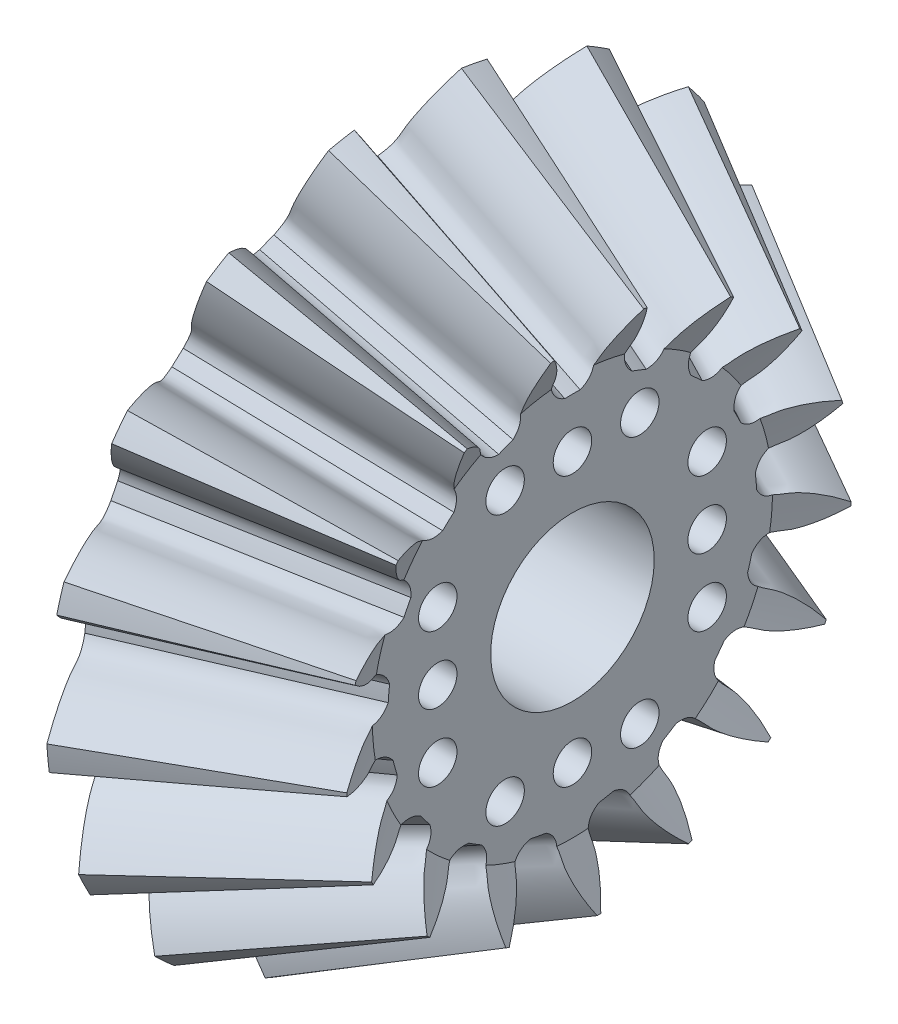
from build123d import *

# Parameters (mm, degrees)
CUT_EXTRUDE1_DEPTH = 33.856357099
CIRPATTERN1_COUNT  = 17
SKETCH2_R          = 11.25
CUT_EXTRUDE2_DEPTH = 5
SKETCH3_R          = 1
CUT_EXTRUDE3_DEPTH = 28.671691276
SKETCH4_R          = 4.25
CUT_EXTRUDE4_DEPTH = 29.902199624


# Read off the part's stored shape, not the designer's step: 旋转1
with BuildPart() as part:
    # 旋转1 outline → 旋转1 (revolve)
    with BuildSketch(Plane.YX):
        Polygon((1.485337474, 6.528961373), (13.057922746, 6.528961373), (18.788854382, 9.394427191), (13.152198067, 19.326099034), (10.397362319, 17.94868116), (1.485337474, 17.94868116), align=None)
    revolve(axis=Axis((0, 0, 0), (1, 0, 0)))

    # Sketch1 → Cut-Extrude1 (cut, through all)
    with BuildSketch(Plane(origin=(0, 0, 0), x_dir=(0, 0, -1), z_dir=(0.8944271909999161, -0.4472135954999577, -1.0341155557737348e-13))):
        with BuildLine():
            ThreePointArc((0.399763229, 16.595185728), (0, 16.6), (-0.399763229, 16.595185728))
            add(Edge.make_bspline(
                [(-0.399763229, 16.595185728), (-1.198985458, 16.885810963), (-1.124727274, 17.473761407), (-1.250725801, 18.040324932), (-1.265059396, 18.099315382), (-1.282397995, 18.164911887), (-1.30300192, 18.237017032), (-1.32714044, 18.315523096), (-1.35507611, 18.400315004), (-1.387069369, 18.491269511), (-1.42337685, 18.588255562), (-1.464251618, 18.6911343), (-1.509942824, 18.799759186), (-1.560695543, 18.913976092), (-1.616750556, 19.033623408), (-1.678344154, 19.158532155), (-1.745707938, 19.288526099), (-1.819068625, 19.423421874), (-1.898647854, 19.563029105), (-1.984662001, 19.707150543), (-2.077321989, 19.855582194), (-2.176833106, 20.008113467), (-2.28339483, 20.164527312), (-2.397200646, 20.324600373), (-2.518437883, 20.488103141), (-2.64728754, 20.654800111), (-2.783924122, 20.824449945), (-2.928515482, 20.996805638), (-3.081222666, 21.171614689), (-3.242199755, 21.348619274), (-3.411593725, 21.527556429), (-3.589544298, 21.708158223), (-3.776183806, 21.890151954), (-3.971637056, 22.073260331), (-4.176021199, 22.257201669), (-4.389445607, 22.441690087), (-4.612011752, 22.626435702), (-4.843813088, 22.811144839), (-5.084934955, 22.995520228), (-5.335454413, 23.179261223), (-5.685997297, 23.425736863), (-5.957412859, 23.60452901), (-6.142627743, 23.721408504)],
                knots=[0, 0, 0, 0, 0.174183236, 0.179918075, 0.186417559, 0.193681688, 0.201710462, 0.210503881, 0.220061946, 0.230384655, 0.24147201, 0.25332401, 0.265940655, 0.279321945, 0.293467881, 0.308378461, 0.324053687, 0.340493557, 0.357698073, 0.375667234, 0.394401041, 0.413899492, 0.434162589, 0.45519033, 0.476982717, 0.499539749, 0.522861426, 0.546947748, 0.571798716, 0.597414328, 0.623794586, 0.650939489, 0.678849037, 0.70752323, 0.736962068, 0.767165552, 0.79813368, 0.829866454, 0.862363873, 0.895625937, 0.929652646, 1, 1, 1, 1], degree=3))
            ThreePointArc((-6.142627743, 23.721408504), (0, 24.503818009), (6.142627743, 23.721408504))
            add(Edge.make_bspline(
                [(0.399763229, 16.595185728), (1.198985458, 16.885810963), (1.124727274, 17.473761407), (1.250725801, 18.040324932), (1.265059396, 18.099315382), (1.282397995, 18.164911887), (1.30300192, 18.237017032), (1.32714044, 18.315523096), (1.35507611, 18.400315004), (1.387069369, 18.491269511), (1.42337685, 18.588255562), (1.464251618, 18.6911343), (1.509942824, 18.799759186), (1.560695543, 18.913976092), (1.616750556, 19.033623408), (1.678344154, 19.158532155), (1.745707938, 19.288526099), (1.819068625, 19.423421874), (1.898647854, 19.563029105), (1.984662001, 19.707150543), (2.077321989, 19.855582194), (2.176833106, 20.008113467), (2.28339483, 20.164527312), (2.397200646, 20.324600373), (2.518437883, 20.488103141), (2.64728754, 20.654800111), (2.783924122, 20.824449945), (2.928515482, 20.996805638), (3.081222666, 21.171614689), (3.242199755, 21.348619274), (3.411593725, 21.527556429), (3.589544298, 21.708158223), (3.776183806, 21.890151954), (3.971637056, 22.073260331), (4.176021199, 22.257201669), (4.389445607, 22.441690087), (4.612011752, 22.626435702), (4.843813088, 22.811144839), (5.084934955, 22.995520228), (5.335454413, 23.179261223), (5.685997297, 23.425736863), (5.957412859, 23.60452901), (6.142627743, 23.721408504)],
                knots=[0, 0, 0, 0, 0.174183236, 0.179918075, 0.186417559, 0.193681688, 0.201710462, 0.210503881, 0.220061946, 0.230384655, 0.24147201, 0.25332401, 0.265940655, 0.279321945, 0.293467881, 0.308378461, 0.324053687, 0.340493557, 0.357698073, 0.375667234, 0.394401041, 0.413899492, 0.434162589, 0.45519033, 0.476982717, 0.499539749, 0.522861426, 0.546947748, 0.571798716, 0.597414328, 0.623794586, 0.650939489, 0.678849037, 0.70752323, 0.736962068, 0.767165552, 0.79813368, 0.829866454, 0.862363873, 0.895625937, 0.929652646, 1, 1, 1, 1], degree=3))
        make_face()
    cut_extrude1 = extrude(amount=CUT_EXTRUDE1_DEPTH, mode=Mode.SUBTRACT)

    # CirPattern1: Cut-Extrude1 ×17 about axis
    cirpattern1_axis = Axis((17.94868116, 0, 0), (1, 0, 0))
    for i in range(1, CIRPATTERN1_COUNT):
        add(cut_extrude1.rotate(cirpattern1_axis, i * 360 / CIRPATTERN1_COUNT), mode=Mode.SUBTRACT)

    # Sketch2 → Cut-Extrude2 (cut)
    with BuildSketch(Plane.ZY.offset(-6.528961373)):
        Circle(SKETCH2_R)
    extrude(amount=-CUT_EXTRUDE2_DEPTH, mode=Mode.SUBTRACT)

    # Sketch3 → Cut-Extrude3 (cut, through all)
    with BuildSketch(Plane.ZY.offset(-11.528961373)):
        with Locations((0, 7)):
            Circle(SKETCH3_R)
        with Locations((3.5, 7)):
            Circle(SKETCH3_R)
        with Locations(Location((-3.5, 7, 0), (0, 0, 180))):
            Circle(SKETCH3_R)
        with Locations(Location((7, 3.5, 0), (0, 0, 180))):
            Circle(SKETCH3_R)
        with Locations((7, 0)):
            Circle(SKETCH3_R)
        with Locations((7, -3.5)):
            Circle(SKETCH3_R)
        with Locations(Location((3.5, -7, 0), (0, 0, 180))):
            Circle(SKETCH3_R)
        with Locations((0, -7)):
            Circle(SKETCH3_R)
        with Locations((-3.5, -7)):
            Circle(SKETCH3_R)
        with Locations(Location((-7, -3.5, 0), (0, 0, 180))):
            Circle(SKETCH3_R)
        with Locations((-7, 0)):
            Circle(SKETCH3_R)
        with Locations((-7, 3.5)):
            Circle(SKETCH3_R)
    extrude(amount=-CUT_EXTRUDE3_DEPTH, mode=Mode.SUBTRACT)

    # Sketch4 → Cut-Extrude4 (cut, through all)
    with BuildSketch(Plane(origin=(17.94868116, 0, 0), x_dir=(0, 0, -1), z_dir=(1, 0, 0))):
        Circle(SKETCH4_R)
    extrude(amount=-CUT_EXTRUDE4_DEPTH, mode=Mode.SUBTRACT)


solid = part.part
